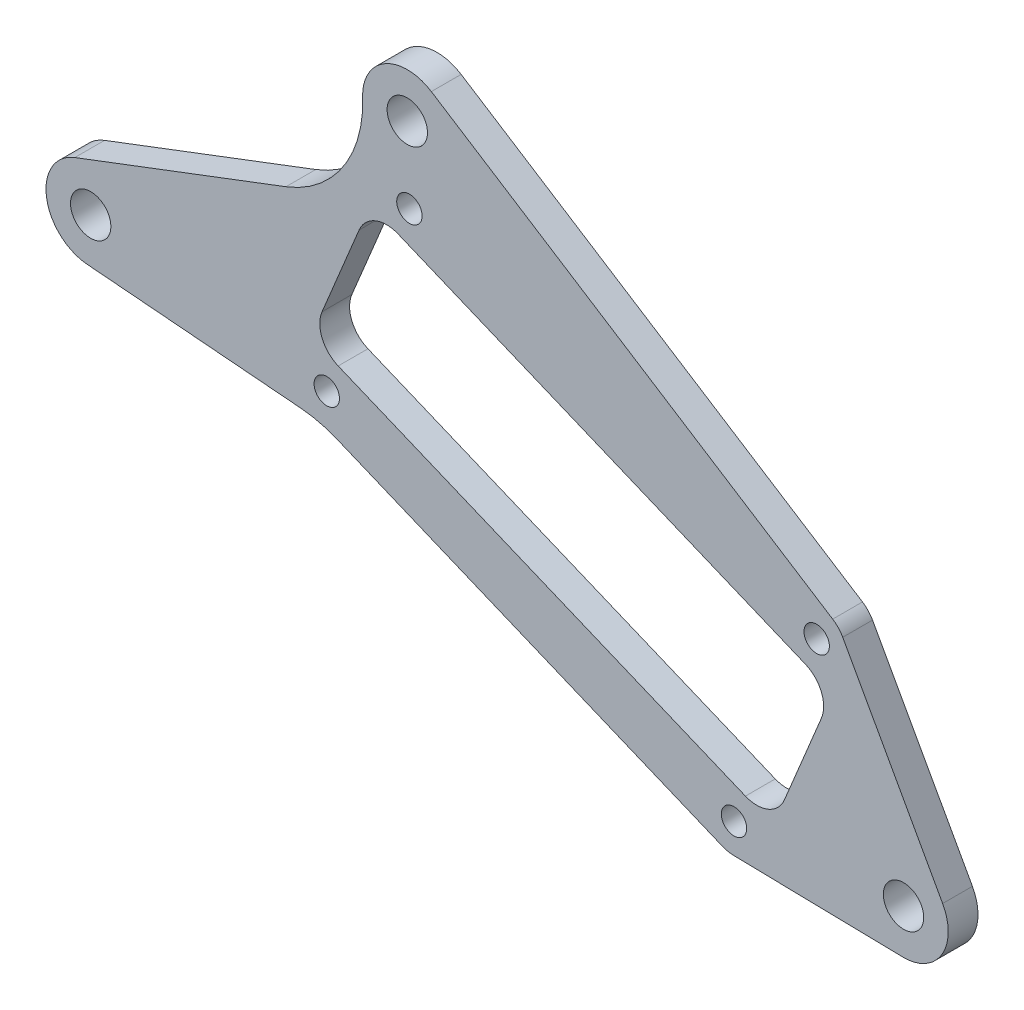
from build123d import *

# Parameters (mm, degrees)
BOSS_EXTRUDE1_DEPTH   = 3.175
FILLET1_R             = 3.175
F_6_CLEARANCE_HOLE1_D = 4.3053
F_2_CLEARANCE_HOLE1_D = 2.7051
FILLET2_R             = 12.7


with BuildPart() as part:
    # Sketch1 → Boss-Extrude1 (new body)
    with BuildSketch(Plane.XY):
        with BuildLine():
            Line((90.821358826, -18.161284348), (80.17216718, 1.094759821))
            ThreePointArc((80.17216718, 1.094759821), (79.70833798, 1.731518351), (79.102014267, 2.234480087))
            Line((79.102014267, 2.234480087), (36.315798025, 29.544973103))
            ThreePointArc((36.315798025, 29.544973103), (31.002904726, 29.418519327), (29.114914109, 24.450791758))
            Line((29.114914109, 24.450791758), (30.886207986, 16.841662569))
            Line((30.886207986, 16.841662569), (-1.692935369, 4.451446516))
            ThreePointArc((-1.692935369, 4.451446516), (-4.715731213, -0.6657968), (-0.394361249, -4.746144273))
            Line((-0.394361249, -4.746144273), (24.410778081, -6.807224837))
            Line((24.410778081, -6.807224837), (67.367437597, -24.620374852))
            ThreePointArc((67.367437597, -24.620374852), (67.932057441, -24.79496394), (68.519252784, -24.861885891))
            Line((68.519252784, -24.861885891), (86.557178011, -25.22763618))
            ThreePointArc((86.557178011, -25.22763618), (90.731319104, -22.926733092), (90.821358826, -18.161284348))
        make_face()
        Polygon((72.732635266, -19.970882517), (23.451745327, 0.464782063), (29.829511311, 15.844853618), (79.11040125, -4.590810962), align=None, mode=Mode.SUBTRACT)
    extrude(amount=BOSS_EXTRUDE1_DEPTH)

    # Fillet1
    fillet1_edges = [part.edges().sort_by_distance(p)[0] for p in [
        (72.732635266, -19.970882517, 1.5875),
        (79.11040125, -4.590810962, 1.5875),
        (23.451745327, 0.464782063, 1.5875),
        (29.829511311, 15.844853618, 1.5875),
    ]]
    fillet(fillet1_edges, radius=FILLET1_R)

    # #6 Clearance Hole1 (through all)
    with Locations(Plane.XY.offset(3.175)):
        with Locations((0, 0), (33.7533947, 25.530562131), (86.653726131, -20.46611492)):
            Hole(F_6_CLEARANCE_HOLE1_D / 2)

    # #2 Clearance Hole1 (through all)
    with Locations(Plane.XY.offset(3.175)):
        with Locations((33.97852838, 17.561509485), (77.393745383, -0.441793894), (68.583618198, -21.687538385), (25.168401194, -3.684235006)):
            Hole(F_2_CLEARANCE_HOLE1_D / 2)

    # Fillet2
    fillet2_edges = [part.edges().sort_by_distance(p)[0] for p in [
        (24.410778081, -6.807224837, 1.5875),
        (30.886207986, 16.841662569, 1.5875),
    ]]
    fillet(fillet2_edges, radius=FILLET2_R)


solid = part.part
